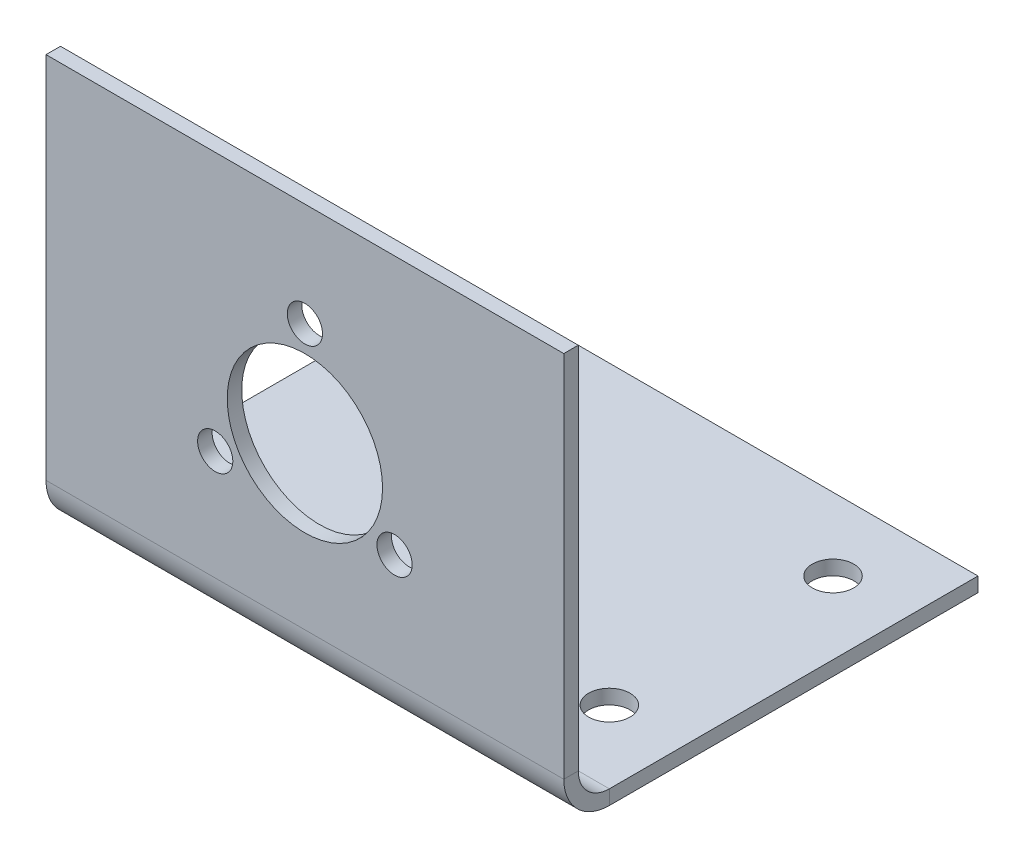
from build123d import *

# Parameters (mm, degrees)
SKETCH6_W                    = 50
SKETCH6_H                    = 40
BASE_FLANGE2_DEPTH           = 1.4
CUT_EXTRUDE2_DEPTH           = 65.046545574
CUT_EXTRUDE2_DEPTH_BACK      = 65.046545574
SKETCH11_R                   = 7.5
SKETCH11_R_2                 = 1.7
EDGE_FLANGE1_STRIP_W         = 11.6
EDGE_FLANGE1_STRIP_H         = 1.4
EDGE_FLANGE1_STRIP_CUT_DEPTH = 50
EDGE_FLANGE1_DEPTH           = 50
SKETCH35_R                   = 2
CUT_EXTRUDE3_DEPTH           = 75.766035069


# Sheet-metal steps are written as plain solids
with BuildPart() as part:
    # Sketch6 → Base-Flange2 (new body)
    with BuildSketch(Plane.XY):
        with Locations((25, 20)):
            Rectangle(SKETCH6_W, SKETCH6_H)
    extrude(amount=-BASE_FLANGE2_DEPTH)

    # Sketch11 → Cut-Extrude2 (cut, two sides: drawn at the far end of the back side and taken through both)
    with BuildSketch(Plane.XY.offset(-1.4).offset(-CUT_EXTRUDE2_DEPTH_BACK)):
        with Locations((25, 20)):
            Circle(SKETCH11_R)
        with Locations((25, 30)):
            Circle(SKETCH11_R_2)
        with Locations((16.339745962, 15)):
            Circle(SKETCH11_R_2)
        with Locations((33.660254038, 15)):
            Circle(SKETCH11_R_2)
    extrude(amount=CUT_EXTRUDE2_DEPTH + CUT_EXTRUDE2_DEPTH_BACK, mode=Mode.SUBTRACT)

    # Edge-Flange1 strip (across the edge) → Edge-Flange1 strip cut (cut)
    with BuildSketch(Plane(origin=(50, 0, -1.4), x_dir=(0, 1, 0), z_dir=(-1, 0, 0))):
        with Locations((-1.4, -0.7)):
            Rectangle(EDGE_FLANGE1_STRIP_W, EDGE_FLANGE1_STRIP_H)
    extrude(amount=EDGE_FLANGE1_STRIP_CUT_DEPTH, mode=Mode.SUBTRACT)

    # Edge-Flange1 section (across the edge) → Edge-Flange1 (add)
    with BuildSketch(Plane(origin=(50, 0, -1.4), x_dir=(0, 1, 0), z_dir=(-1, 0, 0))):
        with BuildLine():
            Line((0, 3), (0, 38.6))
            Line((0, 38.6), (1.4, 38.6))
            Line((1.4, 38.6), (1.4, 3))
            ThreePointArc((1.4, 3), (2.278679656, 0.878679656), (4.4, 0))
            Line((4.4, 0), (4.4, -1.4))
            ThreePointArc((4.4, -1.4), (1.288730163, -0.111269837), (0, 3))
        make_face()
    extrude(amount=EDGE_FLANGE1_DEPTH)

    # Sketch35 → Cut-Extrude3 (cut, through all)
    with BuildSketch(Plane(origin=(0, 1.4, 0), x_dir=(1, 0, 0), z_dir=(0, 1, 0))):
        with Locations(Location((43, 11.4, 0), (0, 0, 270))):
            Circle(SKETCH35_R)
        with Locations(Location((7, 11.4, 0), (0, 0, 270))):
            Circle(SKETCH35_R)
        with Locations(Location((43, 33, 0), (0, 0, 270))):
            Circle(SKETCH35_R)
        with Locations(Location((7, 33, 0), (0, 0, 270))):
            Circle(SKETCH35_R)
    extrude(amount=-CUT_EXTRUDE3_DEPTH, mode=Mode.SUBTRACT)


solid = part.part
